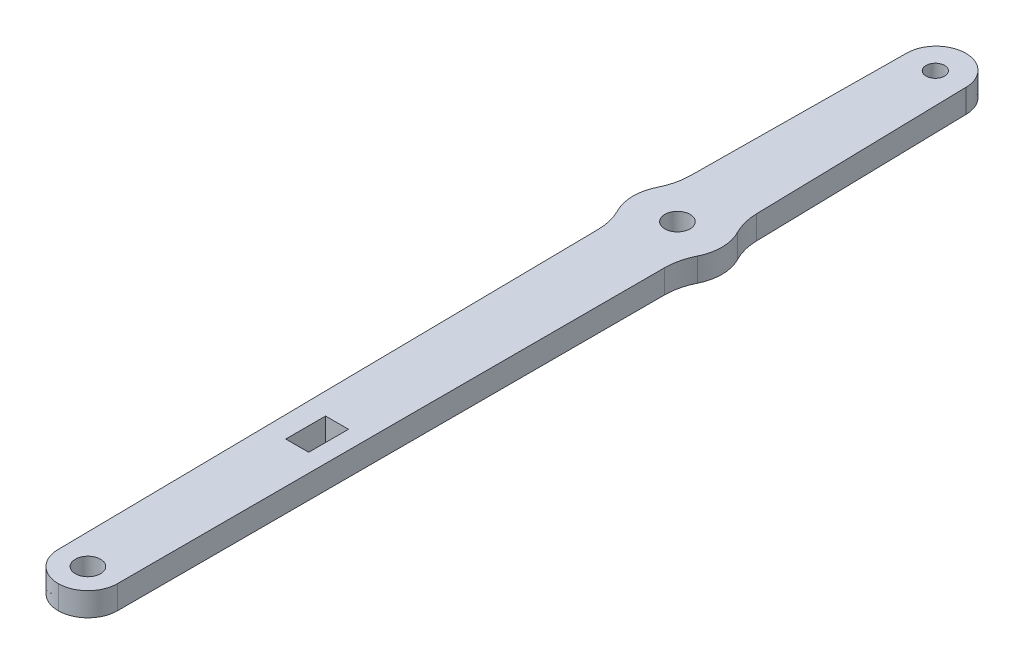
from build123d import *

# Parameters (mm, degrees)
SKETCH1_R           = 1.7
SKETCH1_R_2         = 1.25
SKETCH1_W           = 3.09412052
SKETCH1_H           = 5.373555217
BOSS_EXTRUDE1_DEPTH = 3.175


with BuildPart() as part:
    # Sketch1 → Boss-Extrude1 (new body)
    with BuildSketch(Plane(origin=(0, 0, 0), x_dir=(1, 0, 0), z_dir=(0, 1, 0))):
        with BuildLine():
            Line((7.757654928, 53.756698658), (7.757654928, 53.656789405))
            Line((7.757654928, 53.656789405), (8.4096439, 24.845324208))
            add(Edge.make_bspline(
                [(8.4096439, 24.845324208), (8.437369029, 23.621548168), (8.744860599, 22.420508075), (9.308994838, 21.334671262)],
                knots=[2, 2, 2, 2, 3, 3, 3, 3], degree=3))
            add(Edge.make_bspline(
                [(9.308994838, 21.334671262), (10.193859299, 19.630295579), (10.210724444, 17.604432818), (9.354111539, 15.885583477)],
                knots=[3, 3, 3, 3, 4, 4, 4, 4], degree=3))
            add(Edge.make_bspline(
                [(9.354111539, 15.885583477), (8.801207732, 14.77576063), (8.513271931, 13.552570568), (8.513271931, 12.312357845)],
                knots=[4, 4, 4, 4, 5, 5, 5, 5], degree=3))
            Line((8.513271931, 12.312357845), (8.513271931, -61.435847895))
            add(Edge.make_bspline(
                [(8.513271931, -61.435847895), (8.513271931, -63.634593706), (6.741690768, -65.42127977), (4.546745712, -65.435812024)],
                knots=[6, 6, 6, 6, 7, 7, 7, 7], degree=3))
            add(Edge.make_bspline(
                [(4.546745712, -65.435812024), (2.351586185, -65.450148953), (0.556705775, -63.687204766), (0.527888798, -61.488458955)],
                knots=[7, 7, 7, 7, 8, 8, 8, 8], degree=3))
            Line((0.527888798, -61.488458955), (-0.439554458, 12.21234727))
            add(Edge.make_bspline(
                [(-0.439554458, 12.21234727), (-0.444960501, 13.452528366), (-0.738276254, 14.674748103), (-1.295963098, 15.781855667)],
                knots=[9, 9, 9, 9, 10, 10, 10, 10], degree=3))
            add(Edge.make_bspline(
                [(-1.295963098, 15.781855667), (-2.189660672, 17.481784633), (-2.216667293, 19.507493532), (-1.368626669, 21.230470586)],
                knots=[11, 11, 11, 11, 12, 12, 12, 12], degree=3))
            Line((-1.368626669, 21.230470586), (-1.35389098, 21.264275769))
            add(Edge.make_bspline(
                [(-1.35389098, 21.264275769), (-0.804457688, 22.357534971), (-0.512661426, 23.562598779), (-0.500924065, 24.786550612)],
                knots=[13, 13, 13, 13, 14, 14, 14, 14], degree=3))
            Line((-0.500924065, 24.786550612), (-0.227084795, 53.604109981))
            Line((-0.227084795, 53.604109981), (-0.227084795, 53.704077832))
            add(Edge.make_bspline(
                [(-0.227084795, 53.704077832), (-0.206456675, 55.888174192), (1.559119327, 57.651675058), (3.739382933, 57.666148715)],
                knots=[16, 16, 16, 16, 17, 17, 17, 17], degree=3))
            add(Edge.make_bspline(
                [(3.739382933, 57.666148715), (5.919510057, 57.680485644), (7.70807335, 55.94020904), (7.757654928, 53.756698658)],
                knots=[17, 17, 17, 17, 18, 18, 18, 18], degree=3))
        make_face()
        with Locations((4.520385389, -61.435755115)):
            Circle(SKETCH1_R, mode=Mode.SUBTRACT)
        with Locations((3.99538219, 18.56551491)):
            Circle(SKETCH1_R, mode=Mode.SUBTRACT)
        with Locations((3.765626269, 53.566050708)):
            Circle(SKETCH1_R_2, mode=Mode.SUBTRACT)
        with Locations((4.520414636, -30.53758799)):
            Rectangle(SKETCH1_W, SKETCH1_H, mode=Mode.SUBTRACT)
    extrude(amount=BOSS_EXTRUDE1_DEPTH)


solid = part.part
